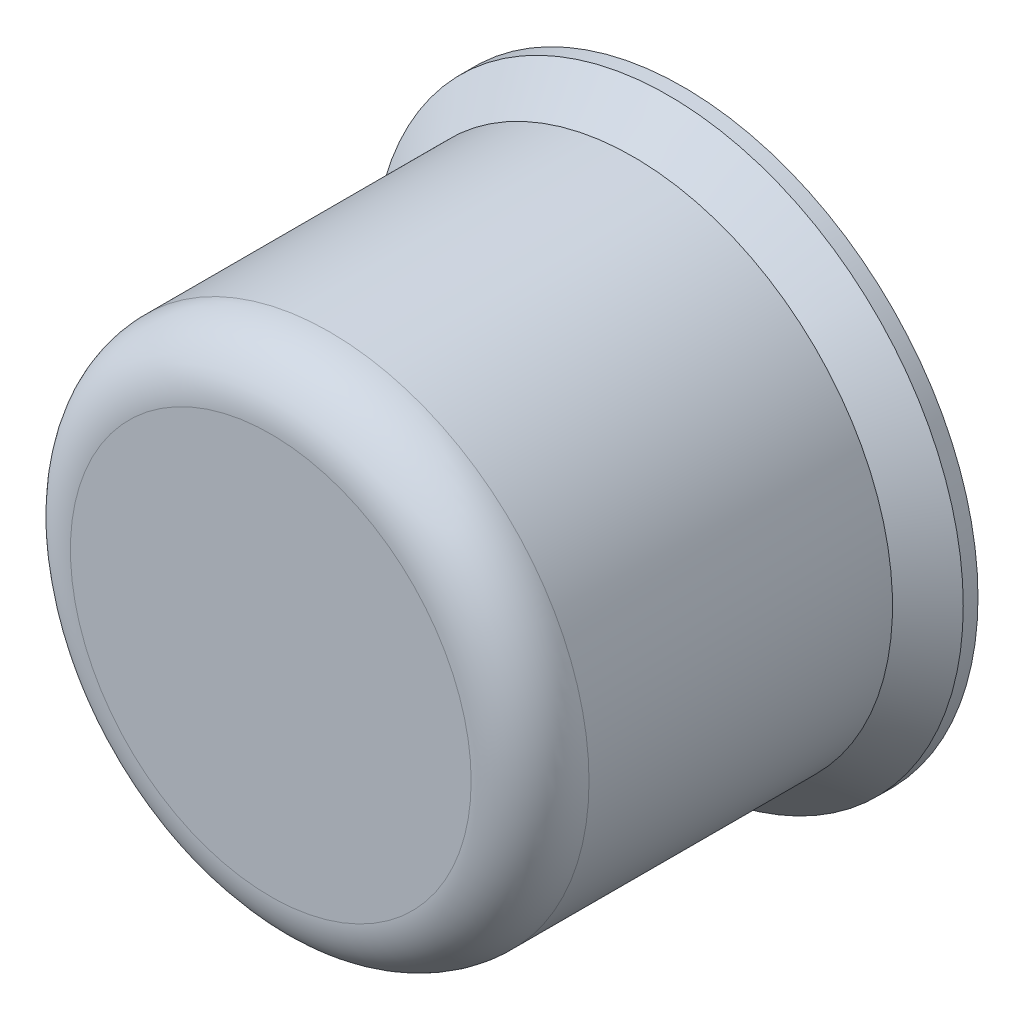
from build123d import *

# Parameters (mm, degrees)
SKETCH1_R           = 5
BOSS_EXTRUDE1_DEPTH = 1
SKETCH2_R           = 4.4
BOSS_EXTRUDE2_DEPTH = 6
FILLET2_R           = 1
CHAMFER1_SIZE       = 0.75


with BuildPart() as part:
    # Sketch1 → Boss-Extrude1 (new body)
    with BuildSketch(Plane.XY):
        Circle(SKETCH1_R)
    extrude(amount=BOSS_EXTRUDE1_DEPTH)

    # Sketch2 → Boss-Extrude2 (add)
    with BuildSketch(Plane.XY.offset(1)):
        Circle(SKETCH2_R)
    extrude(amount=BOSS_EXTRUDE2_DEPTH)

    # Fillet2
    fillet2_edges = [part.edges().sort_by_distance(p)[0] for p in [
        (-4.4, 0, 7),
    ]]
    fillet(fillet2_edges, radius=FILLET2_R)

    # Chamfer1
    # the kernel refuses this chamfer: 0.75 mm, written as the material it takes off along each edge
    with BuildSketch(Plane(origin=(0, 0, 1), x_dir=(1, 0, 0), z_dir=(0, -1, 0))) as chamfer1_piece_1_section:
        Polygon((5 - CHAMFER1_SIZE, 0), (5, -CHAMFER1_SIZE), (5, 0), align=None)
    chamfer1_piece_1 = revolve(axis=Axis((0, 0, 1), (0, 0, 1)), mode=Mode.PRIVATE)
    chamfer1_piece_1 = chamfer1_piece_1 - Plane(origin=(0, 0, 0.553993393), x_dir=(1, 0, 0), z_dir=(0, 0, -1)) * Cylinder(4.4, 20, mode=Mode.PRIVATE)
    add(chamfer1_piece_1, mode=Mode.SUBTRACT)


solid = part.part
